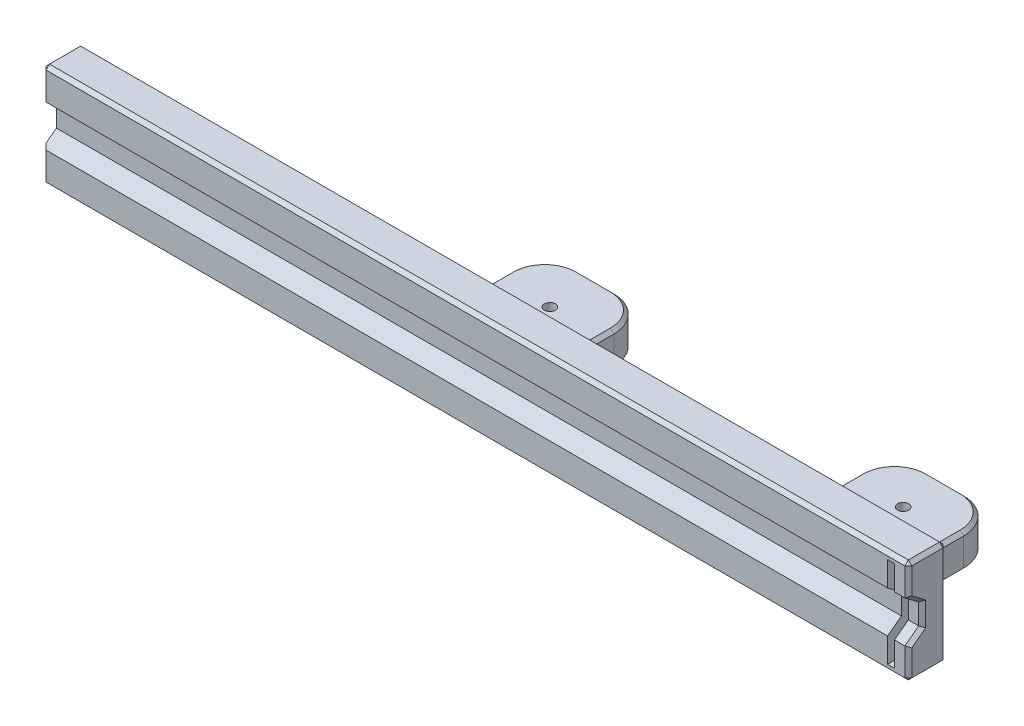
from build123d import *

# Parameters (mm, degrees)
SKETCH_1_W               = 250
SKETCH_1_H               = 30
EXTRUDE_1_DEPTH          = 11
SKETCH_4_W               = 30
SKETCH_4_H               = 10
EXTRUDE_2_DEPTH          = 25
CUT_EXTRUDE_2_DEPTH      = 254.031618578
EXTRUDE_4_DEPTH          = 25
SKETCH_12_R              = 1.6
CUT_EXTRUDE_5_DEPTH      = 253.041663223
FILLET_1_R               = 10
SKETCH_13_W              = 2
SKETCH_13_H              = 26.2
CUT_EXTRUDE_6_DEPTH      = 255.354083907
CHAMFER_1_SIZE           = 1
CUT_EXTRUDE_7_DEPTH      = 253.041663223
CUT_EXTRUDE_7_DEPTH_BACK = 253.041663223
SKETCH_15_R              = 1.6


with BuildPart() as part:
    # 草圖1 → 填料-伸長1 (new body)
    with BuildSketch(Plane.XY):
        with Locations((125, 15)):
            Rectangle(SKETCH_1_W, SKETCH_1_H)
    extrude(amount=EXTRUDE_1_DEPTH)

    # 草圖4 → 填料-伸長2 (add)
    with BuildSketch(Plane(origin=(0, 0, 0), x_dir=(-1, 0, 0), z_dir=(0, 0, -1))):
        with Locations((-124, 15)):
            Rectangle(SKETCH_4_W, SKETCH_4_H)
    extrude(amount=EXTRUDE_2_DEPTH)

    # 草圖5 → 除料-伸長2 (cut, through all)
    with BuildSketch(Plane(origin=(250, 0, 0), x_dir=(0, 0, -1), z_dir=(1, 0, 0))):
        Polygon((-11, 21), (-11, 9), (-7, 12), (-7, 18), align=None)
    extrude(amount=-CUT_EXTRUDE_2_DEPTH, mode=Mode.SUBTRACT)

    # 草圖11 → 填料-伸長4 (add)
    with BuildSketch(Plane(origin=(0, 0, 0), x_dir=(-1, 0, 0), z_dir=(0, 0, -1))):
        Polygon((-240, 20), (-240, 10), (-210, 10), (-210, 15), (-210, 20), align=None)
    extrude(amount=EXTRUDE_4_DEPTH)

    # 草圖12 → 除料-伸長5 (cut, through all)
    with BuildSketch(Plane(origin=(0, 20, 0), x_dir=(1, 0, 0), z_dir=(0, 1, 0))):
        with Locations((225, 12.5)):
            Circle(SKETCH_12_R)
    extrude(amount=-CUT_EXTRUDE_5_DEPTH, mode=Mode.SUBTRACT)

    # 圓角1
    fillet_1_edges = [part.edges().sort_by_distance(p)[0] for p in [
        (109, 15, -25),
        (139, 15, -25),
        (210, 15, -25),
        (240, 15, -25),
    ]]
    fillet(fillet_1_edges, radius=FILLET_1_R)

    # 草圖13 → 除料-伸長6 (cut, through all)
    with BuildSketch(Plane.XY.offset(11)):
        with Locations((245, 15)):
            Rectangle(SKETCH_13_W, SKETCH_13_H)
    extrude(amount=-CUT_EXTRUDE_6_DEPTH, mode=Mode.SUBTRACT)

    # 導角1
    chamfer_1_edges = [part.edges().sort_by_distance(p)[0] for p in [
        (250, 15, 0),
        (250, 30, 5.5),
        (250, 0, 5.5),
        (125, 30, 11),
        (125, 0, 11),
        (0, 30, 5.5),
        (125, 30, 0),
        (125, 0, 0),
        (0, 15, 0),
        (0, 0, 5.5),
        (225, 10, -25),
        (225, 20, -25),
        (212.928932188, 20, -22.071067812),
        (212.928932188, 10, -22.071067812),
        (237.071067812, 10, -22.071067812),
        (237.071067812, 20, -22.071067812),
        (225, 20, 0),
        (210, 20, -7.5),
        (210, 15, 0),
        (210, 10, -7.5),
        (225, 10, 0),
        (240, 10, -7.5),
        (240, 15, 0),
        (240, 20, -7.5),
        (124, 20, -25),
        (124, 10, -25),
        (111.928932188, 20, -22.071067812),
        (111.928932188, 10, -22.071067812),
        (136.071067812, 20, -22.071067812),
        (136.071067812, 10, -22.071067812),
        (109, 20, -7.5),
        (124, 10, 0),
        (109, 10, -7.5),
        (109, 15, 0),
        (124, 20, 0),
        (139, 20, -7.5),
        (139, 15, 0),
        (139, 10, -7.5),
        (250, 4.5, 11),
        (250, 10.5, 9),
        (250, 15, 7),
        (250, 19.5, 9),
        (250, 25.5, 11),
        (0, 25.5, 11),
        (0, 4.5, 11),
    ]]
    chamfer(chamfer_1_edges, length=CHAMFER_1_SIZE)

    # 草圖15 → 除料-伸長7 (cut, two sides: drawn at the far end of the back side and taken through both)
    with BuildSketch(Plane.XZ.offset(-10).offset(-CUT_EXTRUDE_7_DEPTH_BACK)):
        with Locations((124, -11.5)):
            Circle(SKETCH_15_R)
    extrude(amount=CUT_EXTRUDE_7_DEPTH + CUT_EXTRUDE_7_DEPTH_BACK, mode=Mode.SUBTRACT)


solid = part.part
